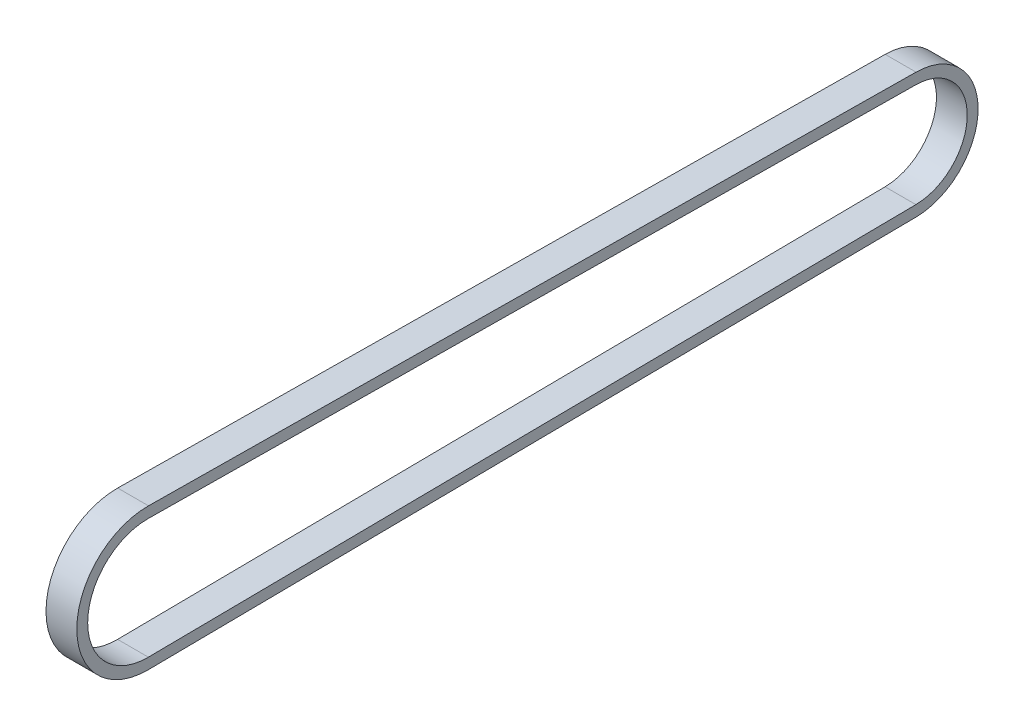
from build123d import *

# Parameters (mm, degrees)
BOSS_EXTRUDE1_DEPTH = 4.5


with BuildPart() as part:
    # Sketch1 → Boss-Extrude1 (new, symmetric)
    with BuildSketch(Plane(origin=(0, 0, 0), x_dir=(0, 0, -1), z_dir=(1, 0, 0))):
        with BuildLine():
            Line((0.220426639, 20.722687697), (224.431338259, 18.337762615))
            ThreePointArc((224.431338259, 18.337762615), (242.57508, 0), (224.431338259, -18.337762615))
            Line((224.431338259, -18.337762615), (0.220426639, -20.722687697))
            ThreePointArc((0.220426639, -20.722687697), (-20.72386, 0), (0.220426639, 20.722687697))
        make_face()
        with BuildLine():
            Line((0.186656165, 17.5478673), (224.397567785, 15.162942217))
            ThreePointArc((224.397567785, 15.162942217), (239.40008, 0), (224.397567785, -15.162942217))
            Line((224.397567785, -15.162942217), (0.186656165, -17.5478673))
            ThreePointArc((0.186656165, -17.5478673), (-17.54886, 0), (0.186656165, 17.5478673))
        make_face(mode=Mode.SUBTRACT)
    extrude(amount=BOSS_EXTRUDE1_DEPTH, both=True)


solid = part.part
